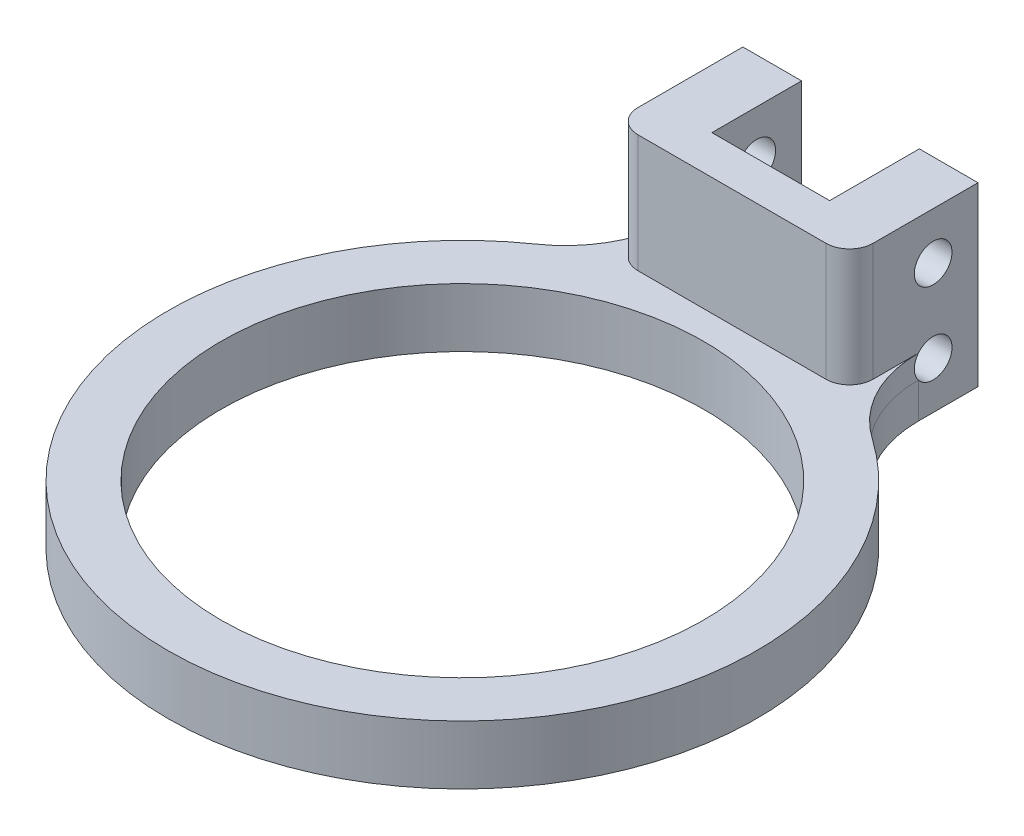
from build123d import *

# Parameters (mm, degrees)
SKETCH_1_R          = 25
SKETCH_1_R_2        = 20.5
EXTRUDE_1_DEPTH     = 5
EXTRUDE_2_DEPTH     = 15
SKETCH_3_R          = 1.6
CUT_EXTRUDE_1_DEPTH = 51.908937006
FILLET_1_R          = 10
FILLET_2_R          = 2


with BuildPart() as part:
    # 草图1 → 凸台-拉伸1 (new body)
    with BuildSketch(Plane(origin=(0, 0, 0), x_dir=(1, 0, 0), z_dir=(0, 1, 0))):
        Circle(SKETCH_1_R)
        Circle(SKETCH_1_R_2, mode=Mode.SUBTRACT)
    extrude(amount=EXTRUDE_1_DEPTH)

    # 草图2 → 凸台-拉伸2 (add)
    with BuildSketch(Plane(origin=(0, 0, 0), x_dir=(1, 0, 0), z_dir=(0, 1, 0))):
        Polygon((-5, 33.807000777), (-9.982946782, 33.807000777), (-9.982946782, 22.896387671), (9.982946782, 22.896387671), (9.982946782, 33.807000777), (5, 33.807000777), (5, 26.192999223), (-5, 26.192999223), align=None)
    extrude(amount=EXTRUDE_2_DEPTH)

    # 草图3 → 切除-拉伸1 (cut, through all)
    with BuildSketch(Plane.ZY.offset(9.982946782)):
        with Locations((-30, 4)):
            Circle(SKETCH_3_R)
        with Locations((-30, 11)):
            Circle(SKETCH_3_R)
    extrude(amount=-CUT_EXTRUDE_1_DEPTH, mode=Mode.SUBTRACT)

    # 圆角1
    fillet_1_edges = [part.edges().sort_by_distance(p)[0] for p in [
        (9.982946782, 2.5, -22.920313557),
        (-9.982946782, 2.5, -22.920313557),
    ]]
    fillet(fillet_1_edges, radius=FILLET_1_R)

    # 圆角2
    fillet_2_edges = [part.edges().sort_by_distance(p)[0] for p in [
        (9.982946782, 10, -22.896387671),
        (-9.982946782, 10, -22.896387671),
    ]]
    fillet(fillet_2_edges, radius=FILLET_2_R)


solid = part.part
